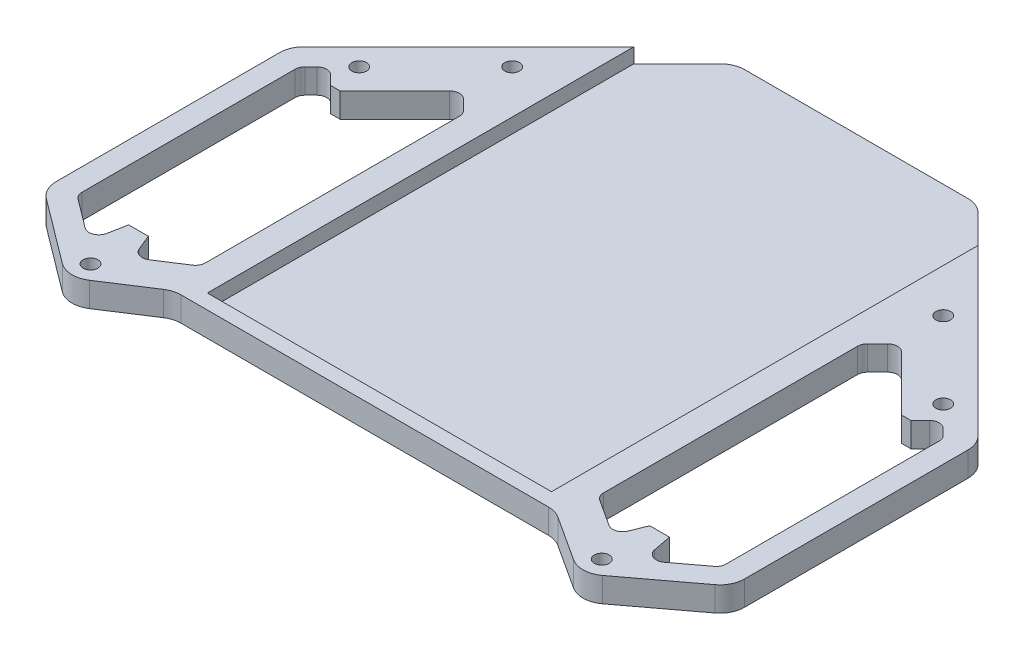
from build123d import *

# Parameters (mm, degrees)
SKETCH1_R            = 1.5
BOSS_EXTRUDE1_DEPTH  = 5
FILLET1_R            = 2
FILLET1_OF_MIRROR1_R = 2
SKETCH2_W            = 70
SKETCH2_H            = 97
CUT_EXTRUDE1_DEPTH   = 3
FILLET2_R            = 5


with BuildPart() as part:
    # Sketch1 → Boss-Extrude1 (new body)
    with BuildSketch(Plane(origin=(0, 0, 0), x_dir=(1, 0, 0), z_dir=(0, 1, 0))):
        Polygon((-52.164149312, -38.645247828), (-70, -25.247940817), (-70, 24.752308679), (-24.752308679, 70), (0, 70), (0, -30), (-38.851635079, -30), align=None)
        with Locations((-43.840620434, 43.840620434)):
            Circle(SKETCH1_R, mode=Mode.SUBTRACT)
        with Locations((-51.997575213, -33.767620171)):
            Circle(SKETCH1_R, mode=Mode.SUBTRACT)
        with Locations((-59.39696962, 28.284271247)):
            Circle(SKETCH1_R, mode=Mode.SUBTRACT)
        Polygon((-59.003765723, 22.1), (-57.095959493, 22.1), (-44.547727215, 34.648232278), (-40.5, 30.600505063), (-40.5, -23), (-48.796166422, -28.387593469), (-51, -23), (-55, -23), (-56.33662338, -29.883022962), (-65.5, -23), (-65.5, 22.181240867), (-62.292503295, 25.388737572), align=None, mode=Mode.SUBTRACT)
    boss_extrude1 = extrude(amount=BOSS_EXTRUDE1_DEPTH)

    # Fillet1
    fillet1_edges = [part.edges().sort_by_distance(p)[0] for p in [
        (-40.5, 2.5, 23),
        (-48.796166422, 2.5, 28.387593469),
        (-56.33662338, 2.5, 29.883022962),
        (-65.5, 2.5, 23),
        (-65.5, 2.5, -22.181240867),
        (-62.292503295, 2.5, -25.388737572),
        (-40.5, 2.5, -30.600505063),
        (-44.547727215, 2.5, -34.648232278),
    ]]
    fillet(fillet1_edges, radius=FILLET1_R)

    # Mirror1: Boss-Extrude1 across plane
    add(boss_extrude1.mirror(Plane(origin=(0, 5, 30), x_dir=(0, 0, 1), z_dir=(-1, 0, 0))))

    # Fillet1 of Mirror1
    fillet1_of_mirror1_edges = [part.edges().sort_by_distance(p)[0] for p in [
        (40.5, 2.5, 23),
        (48.796166422, 2.5, 28.387593469),
        (56.33662338, 2.5, 29.883022962),
        (65.5, 2.5, 23),
        (65.5, 2.5, -22.181240867),
        (62.292503295, 2.5, -25.388737572),
        (40.5, 2.5, -30.600505063),
        (44.547727215, 2.5, -34.648232278),
    ]]
    fillet(fillet1_of_mirror1_edges, radius=FILLET1_OF_MIRROR1_R)

    # Sketch2 → Cut-Extrude1 (cut)
    with BuildSketch(Plane(origin=(0, 5, 0), x_dir=(1, 0, 0), z_dir=(0, 1, 0))):
        with Locations((0, 21.5)):
            Rectangle(SKETCH2_W, SKETCH2_H)
    extrude(amount=-CUT_EXTRUDE1_DEPTH, mode=Mode.SUBTRACT)

    # Fillet2
    fillet2_edges = [part.edges().sort_by_distance(p)[0] for p in [
        (70, 2.5, -24.752308679),
        (24.752308679, 1, -70),
        (-24.752308679, 1, -70),
        (-70, 2.5, -24.752308679),
        (-70, 2.5, 25.247940817),
        (70, 2.5, 25.247940817),
        (52.164149312, 2.5, 38.645247828),
        (38.851635079, 2.5, 30),
        (-38.851635079, 2.5, 30),
        (-52.164149312, 2.5, 38.645247828),
    ]]
    fillet(fillet2_edges, radius=FILLET2_R)


solid = part.part
